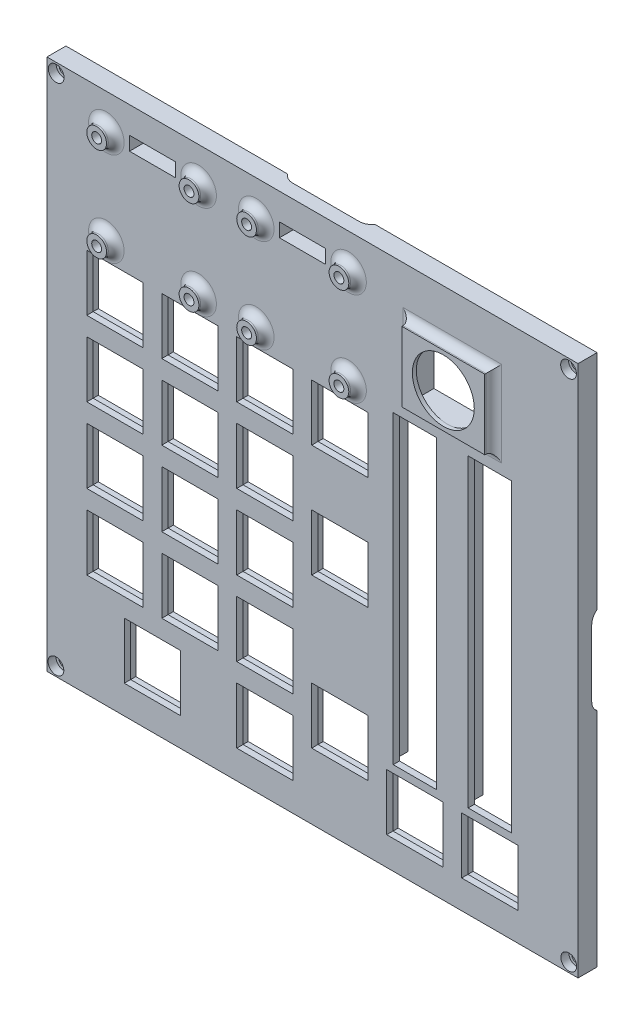
from build123d import *

# Parameters (mm, degrees)
SKETCH1_W                 = 126
SKETCH1_H                 = 126
SKETCH1_W_2               = 18.1
SKETCH1_H_2               = 18.1
SKETCH1_R                 = 1.25
SKETCH1_W_3               = 11.659999313
SKETCH1_H_3               = 3.5
BOSS_EXTRUDE1_DEPTH       = 3.2116
BOSS_EXTRUDE2_START       = 3.2116
BOSS_EXTRUDE2_OUTLINE_W   = 126
BOSS_EXTRUDE2_OUTLINE_H   = 126
BOSS_EXTRUDE2_OUTLINE_W_2 = 14.3
BOSS_EXTRUDE2_OUTLINE_H_2 = 14.3
BOSS_EXTRUDE2_OUTLINE_W_3 = 11
BOSS_EXTRUDE2_OUTLINE_H_3 = 77.272463861
BOSS_EXTRUDE2_OUTLINE_R   = 1.25
BOSS_EXTRUDE2_OUTLINE_W_4 = 11.659999313
BOSS_EXTRUDE2_OUTLINE_H_4 = 3.5
BOSS_EXTRUDE2_OUTLINE_W_5 = 19
BOSS_EXTRUDE2_OUTLINE_H_5 = 15.6999998
BOSS_EXTRUDE2_DEPTH       = 1.6
SKETCH3_R                 = 2.5
SKETCH3_R_2               = 1.25
BOSS_EXTRUDE3_DEPTH       = 2.4544
FILLET1_R                 = 2
SKETCH4_W                 = 21
SKETCH4_H                 = 17.6999998
SKETCH4_W_2               = 19
SKETCH4_H_2               = 15.6999998
BOSS_EXTRUDE4_DEPTH       = 2.3
BOSS_EXTRUDE5_START       = 7.1116
BOSS_EXTRUDE5_DEPTH       = 1
FILLET2_R                 = 2
BOSS_EXTRUDE6_DEPTH       = 3.45
BOSS_EXTRUDE7_DEPTH       = 3.55
BOSS_EXTRUDE8_START       = 3.55
BOSS_EXTRUDE8_DEPTH       = 3.55
BOSS_EXTRUDE9_START       = 3.7
BOSS_EXTRUDE9_DEPTH       = 3.7
BOSS_EXTRUDE10_DEPTH      = 0.8
BOSS_EXTRUDE11_DEPTH      = 0.8
BOSS_EXTRUDE12_START      = 0.8
BOSS_EXTRUDE12_DEPTH      = 0.8
BOSS_EXTRUDE13_START      = 0.8
BOSS_EXTRUDE13_DEPTH      = 0.8
SKETCH13_R                = 1.25
CUT_EXTRUDE1_DEPTH        = 4.8116
SKETCH14_R                = 2
CUT_EXTRUDE2_DEPTH        = 2


# Read off the part's stored shape, not the designer's step: Boss-Extrude2
with BuildPart() as part:
    # Sketch1 → Boss-Extrude1 (new body)
    with BuildSketch(Plane.XY):
        Rectangle(SKETCH1_W, SKETCH1_H)
        with Locations((-40.5, -53)):
            Rectangle(SKETCH1_W_2, SKETCH1_H_2, mode=Mode.SUBTRACT)
        with Locations((-50, -34)):
            Rectangle(SKETCH1_W_2, SKETCH1_H_2, mode=Mode.SUBTRACT)
        with Locations((-12, -53)):
            Rectangle(SKETCH1_W_2, SKETCH1_H_2, mode=Mode.SUBTRACT)
        with Locations((-31, -34)):
            Rectangle(SKETCH1_W_2, SKETCH1_H_2, mode=Mode.SUBTRACT)
        with Locations((-12, -34)):
            Rectangle(SKETCH1_W_2, SKETCH1_H_2, mode=Mode.SUBTRACT)
        with Locations((-50, -15)):
            Rectangle(SKETCH1_W_2, SKETCH1_H_2, mode=Mode.SUBTRACT)
        with Locations((-31, -15)):
            Rectangle(SKETCH1_W_2, SKETCH1_H_2, mode=Mode.SUBTRACT)
        with Locations((-12, -15)):
            Rectangle(SKETCH1_W_2, SKETCH1_H_2, mode=Mode.SUBTRACT)
        with Locations((7, -43.5)):
            Rectangle(SKETCH1_W_2, SKETCH1_H_2, mode=Mode.SUBTRACT)
        with Locations((7, -5.5)):
            Rectangle(SKETCH1_W_2, SKETCH1_H_2, mode=Mode.SUBTRACT)
        Polygon((35.05, -62.05), (16.95, -62.05), (16.95, -43.95), (19.5, -43.95), (19.5, 34.322463861), (32.5, 34.322463861), (32.5, -43.95), (35.05, -43.95), align=None, mode=Mode.SUBTRACT)
        Polygon((54.05, -62.05), (35.95, -62.05), (35.95, -43.95), (38.5, -43.95), (38.5, 34.322463861), (51.5, 34.322463861), (51.5, -43.95), (54.05, -43.95), align=None, mode=Mode.SUBTRACT)
        with Locations((-50, 4)):
            Rectangle(SKETCH1_W_2, SKETCH1_H_2, mode=Mode.SUBTRACT)
        with Locations((-50, 23)):
            Rectangle(SKETCH1_W_2, SKETCH1_H_2, mode=Mode.SUBTRACT)
        with Locations((-31, 4)):
            Rectangle(SKETCH1_W_2, SKETCH1_H_2, mode=Mode.SUBTRACT)
        with Locations((-12, 4)):
            Rectangle(SKETCH1_W_2, SKETCH1_H_2, mode=Mode.SUBTRACT)
        with Locations((-31, 23)):
            Rectangle(SKETCH1_W_2, SKETCH1_H_2, mode=Mode.SUBTRACT)
        with Locations((-12, 23)):
            Rectangle(SKETCH1_W_2, SKETCH1_H_2, mode=Mode.SUBTRACT)
        with Locations((-52.2, 34.7)):
            Circle(SKETCH1_R, mode=Mode.SUBTRACT)
        with Locations((-52.2, 58.5)):
            Circle(SKETCH1_R, mode=Mode.SUBTRACT)
        with Locations((-40.500000725, 59.025)):
            Rectangle(SKETCH1_W_3, SKETCH1_H_3, mode=Mode.SUBTRACT)
        with Locations((-28.8, 34.7)):
            Circle(SKETCH1_R, mode=Mode.SUBTRACT)
        with Locations((-14.2, 34.7)):
            Circle(SKETCH1_R, mode=Mode.SUBTRACT)
        with Locations((-28.8, 58.5)):
            Circle(SKETCH1_R, mode=Mode.SUBTRACT)
        with Locations((-14.2, 58.5)):
            Circle(SKETCH1_R, mode=Mode.SUBTRACT)
        with Locations((-2.500000725, 59.025)):
            Rectangle(SKETCH1_W_3, SKETCH1_H_3, mode=Mode.SUBTRACT)
        with Locations((7, 23)):
            Rectangle(SKETCH1_W_2, SKETCH1_H_2, mode=Mode.SUBTRACT)
        with Locations((9.2, 34.7)):
            Circle(SKETCH1_R, mode=Mode.SUBTRACT)
        with Locations((9.2, 58.5)):
            Circle(SKETCH1_R, mode=Mode.SUBTRACT)
        Polygon((35.5, 38.9500001), (26, 38.9500001), (26, 54.6499999), (35.5, 54.6499999), (45, 54.6499999), (45, 38.9500001), align=None, mode=Mode.SUBTRACT)
    extrude(amount=BOSS_EXTRUDE1_DEPTH)

    # Boss-Extrude2 outline → Boss-Extrude2 (add)
    with BuildSketch(Plane.XY.offset(BOSS_EXTRUDE2_START)):
        Rectangle(BOSS_EXTRUDE2_OUTLINE_W, BOSS_EXTRUDE2_OUTLINE_H)
        with Locations((-40.5, -53)):
            Rectangle(BOSS_EXTRUDE2_OUTLINE_W_2, BOSS_EXTRUDE2_OUTLINE_H_2, mode=Mode.SUBTRACT)
        with Locations((-50, -34)):
            Rectangle(BOSS_EXTRUDE2_OUTLINE_W_2, BOSS_EXTRUDE2_OUTLINE_H_2, mode=Mode.SUBTRACT)
        with Locations((-12, -53)):
            Rectangle(BOSS_EXTRUDE2_OUTLINE_W_2, BOSS_EXTRUDE2_OUTLINE_H_2, mode=Mode.SUBTRACT)
        with Locations((-31, -34)):
            Rectangle(BOSS_EXTRUDE2_OUTLINE_W_2, BOSS_EXTRUDE2_OUTLINE_H_2, mode=Mode.SUBTRACT)
        with Locations((-12, -34)):
            Rectangle(BOSS_EXTRUDE2_OUTLINE_W_2, BOSS_EXTRUDE2_OUTLINE_H_2, mode=Mode.SUBTRACT)
        with Locations((-50, -15)):
            Rectangle(BOSS_EXTRUDE2_OUTLINE_W_2, BOSS_EXTRUDE2_OUTLINE_H_2, mode=Mode.SUBTRACT)
        with Locations((-31, -15)):
            Rectangle(BOSS_EXTRUDE2_OUTLINE_W_2, BOSS_EXTRUDE2_OUTLINE_H_2, mode=Mode.SUBTRACT)
        with Locations((-12, -15)):
            Rectangle(BOSS_EXTRUDE2_OUTLINE_W_2, BOSS_EXTRUDE2_OUTLINE_H_2, mode=Mode.SUBTRACT)
        with Locations((26, -53)):
            Rectangle(BOSS_EXTRUDE2_OUTLINE_W_2, BOSS_EXTRUDE2_OUTLINE_H_2, mode=Mode.SUBTRACT)
        with Locations((7, -43.5)):
            Rectangle(BOSS_EXTRUDE2_OUTLINE_W_2, BOSS_EXTRUDE2_OUTLINE_H_2, mode=Mode.SUBTRACT)
        with Locations((45, -53)):
            Rectangle(BOSS_EXTRUDE2_OUTLINE_W_2, BOSS_EXTRUDE2_OUTLINE_H_2, mode=Mode.SUBTRACT)
        with Locations((7, -5.5)):
            Rectangle(BOSS_EXTRUDE2_OUTLINE_W_2, BOSS_EXTRUDE2_OUTLINE_H_2, mode=Mode.SUBTRACT)
        with Locations((26, -5.31376807)):
            Rectangle(BOSS_EXTRUDE2_OUTLINE_W_3, BOSS_EXTRUDE2_OUTLINE_H_3, mode=Mode.SUBTRACT)
        with Locations((45, -5.31376807)):
            Rectangle(BOSS_EXTRUDE2_OUTLINE_W_3, BOSS_EXTRUDE2_OUTLINE_H_3, mode=Mode.SUBTRACT)
        with Locations((-50, 4)):
            Rectangle(BOSS_EXTRUDE2_OUTLINE_W_2, BOSS_EXTRUDE2_OUTLINE_H_2, mode=Mode.SUBTRACT)
        with Locations((-50, 23)):
            Rectangle(BOSS_EXTRUDE2_OUTLINE_W_2, BOSS_EXTRUDE2_OUTLINE_H_2, mode=Mode.SUBTRACT)
        with Locations((-31, 4)):
            Rectangle(BOSS_EXTRUDE2_OUTLINE_W_2, BOSS_EXTRUDE2_OUTLINE_H_2, mode=Mode.SUBTRACT)
        with Locations((-12, 4)):
            Rectangle(BOSS_EXTRUDE2_OUTLINE_W_2, BOSS_EXTRUDE2_OUTLINE_H_2, mode=Mode.SUBTRACT)
        with Locations((-31, 23)):
            Rectangle(BOSS_EXTRUDE2_OUTLINE_W_2, BOSS_EXTRUDE2_OUTLINE_H_2, mode=Mode.SUBTRACT)
        with Locations((-12, 23)):
            Rectangle(BOSS_EXTRUDE2_OUTLINE_W_2, BOSS_EXTRUDE2_OUTLINE_H_2, mode=Mode.SUBTRACT)
        with Locations((-52.2, 34.7)):
            Circle(BOSS_EXTRUDE2_OUTLINE_R, mode=Mode.SUBTRACT)
        with Locations((-52.2, 58.5)):
            Circle(BOSS_EXTRUDE2_OUTLINE_R, mode=Mode.SUBTRACT)
        with Locations((-40.500000725, 59.025)):
            Rectangle(BOSS_EXTRUDE2_OUTLINE_W_4, BOSS_EXTRUDE2_OUTLINE_H_4, mode=Mode.SUBTRACT)
        with Locations((-28.8, 34.7)):
            Circle(BOSS_EXTRUDE2_OUTLINE_R, mode=Mode.SUBTRACT)
        with Locations((-14.2, 34.7)):
            Circle(BOSS_EXTRUDE2_OUTLINE_R, mode=Mode.SUBTRACT)
        with Locations((-28.8, 58.5)):
            Circle(BOSS_EXTRUDE2_OUTLINE_R, mode=Mode.SUBTRACT)
        with Locations((-14.2, 58.5)):
            Circle(BOSS_EXTRUDE2_OUTLINE_R, mode=Mode.SUBTRACT)
        with Locations((-2.500000725, 59.025)):
            Rectangle(BOSS_EXTRUDE2_OUTLINE_W_4, BOSS_EXTRUDE2_OUTLINE_H_4, mode=Mode.SUBTRACT)
        with Locations((7, 23)):
            Rectangle(BOSS_EXTRUDE2_OUTLINE_W_2, BOSS_EXTRUDE2_OUTLINE_H_2, mode=Mode.SUBTRACT)
        with Locations((9.2, 34.7)):
            Circle(BOSS_EXTRUDE2_OUTLINE_R, mode=Mode.SUBTRACT)
        with Locations((9.2, 58.5)):
            Circle(BOSS_EXTRUDE2_OUTLINE_R, mode=Mode.SUBTRACT)
        with Locations((35.5, 46.8)):
            Rectangle(BOSS_EXTRUDE2_OUTLINE_W_5, BOSS_EXTRUDE2_OUTLINE_H_5, mode=Mode.SUBTRACT)
    extrude(amount=BOSS_EXTRUDE2_DEPTH)

    # Sketch3 → Boss-Extrude3 (add)
    # profile 1 of 8: a face of its own
    with BuildSketch(Plane.XY.offset(4.8116)):
        with Locations(Location((-52.2, 58.5, 0), (0, 0, 180))):
            Circle(SKETCH3_R)
        with Locations((-52.2, 58.5)):
            Circle(SKETCH3_R_2, mode=Mode.SUBTRACT)
    # profile 2 of 8: a face of its own
    with BuildSketch(Plane.XY.offset(4.8116)):
        with Locations(Location((-28.8, 58.5, 0), (0, 0, 180))):
            Circle(SKETCH3_R)
        with Locations((-28.8, 58.5)):
            Circle(SKETCH3_R_2, mode=Mode.SUBTRACT)
    # profile 3 of 8: a face of its own
    with BuildSketch(Plane.XY.offset(4.8116)):
        with Locations(Location((-14.2, 58.5, 0), (0, 0, 180))):
            Circle(SKETCH3_R)
        with Locations((-14.2, 58.5)):
            Circle(SKETCH3_R_2, mode=Mode.SUBTRACT)
    # profile 4 of 8: a face of its own
    with BuildSketch(Plane.XY.offset(4.8116)):
        with Locations(Location((9.2, 58.5, 0), (0, 0, 180))):
            Circle(SKETCH3_R)
        with Locations((9.2, 58.5)):
            Circle(SKETCH3_R_2, mode=Mode.SUBTRACT)
    # profile 5 of 8: a face of its own
    with BuildSketch(Plane.XY.offset(4.8116)):
        with Locations(Location((-52.2, 34.7, 0), (0, 0, 180))):
            Circle(SKETCH3_R)
        with Locations((-52.2, 34.7)):
            Circle(SKETCH3_R_2, mode=Mode.SUBTRACT)
    # profile 6 of 8: a face of its own
    with BuildSketch(Plane.XY.offset(4.8116)):
        with Locations(Location((-28.8, 34.7, 0), (0, 0, 180))):
            Circle(SKETCH3_R)
        with Locations((-28.8, 34.7)):
            Circle(SKETCH3_R_2, mode=Mode.SUBTRACT)
    # profile 7 of 8: a face of its own
    with BuildSketch(Plane.XY.offset(4.8116)):
        with Locations(Location((-14.2, 34.7, 0), (0, 0, 180))):
            Circle(SKETCH3_R)
        with Locations((-14.2, 34.7)):
            Circle(SKETCH3_R_2, mode=Mode.SUBTRACT)
    # profile 8 of 8: a face of its own
    with BuildSketch(Plane.XY.offset(4.8116)):
        with Locations(Location((9.2, 34.7, 0), (0, 0, 180))):
            Circle(SKETCH3_R)
        with Locations((9.2, 34.7)):
            Circle(SKETCH3_R_2, mode=Mode.SUBTRACT)
    extrude(amount=BOSS_EXTRUDE3_DEPTH)

    # Fillet1
    fillet1_edges = [part.edges().sort_by_distance(p)[0] for p in [
        (-49.7, 58.5, 4.8116),
        (-26.3, 58.5, 4.8116),
        (-11.7, 58.5, 4.8116),
        (11.7, 58.5, 4.8116),
        (-49.7, 34.7, 4.8116),
        (-26.3, 34.7, 4.8116),
        (-11.7, 34.7, 4.8116),
        (11.7, 34.7, 4.8116),
    ]]
    fillet(fillet1_edges, radius=FILLET1_R - 0.0001)  # a hair under: the kernel refuses the full size

    # Sketch4 → Boss-Extrude4 (add)
    with BuildSketch(Plane.XY.offset(4.8116)):
        with Locations((35.5, 46.8)):
            Rectangle(SKETCH4_W, SKETCH4_H)
        with Locations((35.5, 46.8)):
            Rectangle(SKETCH4_W_2, SKETCH4_H_2, mode=Mode.SUBTRACT)
    extrude(amount=BOSS_EXTRUDE4_DEPTH)

    # Sketch1<6> → Boss-Extrude5 (add)
    with BuildSketch(Plane.XY.offset(BOSS_EXTRUDE5_START)):
        with BuildLine():
            Line((26, 54.6499999), (26, 38.9500001))
            Line((26, 38.9500001), (35.5, 38.9500001))
            ThreePointArc((35.5, 38.9500001), (27.6500001, 46.8), (35.5, 54.6499999))
            Line((35.5, 54.6499999), (26, 54.6499999))
        make_face()
        with BuildLine():
            ThreePointArc((43.3499999, 46.8), (41.050788162, 41.249211838), (35.5, 38.9500001))
            Line((35.5, 38.9500001), (45, 38.9500001))
            Line((45, 38.9500001), (45, 54.6499999))
            Line((45, 54.6499999), (35.5, 54.6499999))
            ThreePointArc((35.5, 54.6499999), (41.050788162, 52.350788162), (43.3499999, 46.8))
        make_face()
    extrude(amount=-BOSS_EXTRUDE5_DEPTH)

    # Fillet2
    fillet2_edges = [part.edges().sort_by_distance(p)[0] for p in [
        (25, 46.8, 4.8116),
        (35.5, 37.9500001, 4.8116),
        (46, 46.8, 4.8116),
        (35.5, 55.6499999, 4.8116),
    ]]
    fillet(fillet2_edges, radius=FILLET2_R)

    # Sketch5 → Boss-Extrude6 (add)
    with BuildSketch(Plane.ZY.offset(63)):
        with BuildLine():
            ThreePointArc((0, 13.082575695), (2.183300133, 11.238612788), (3, 8.5))
            Line((3, 8.5), (3, -8.5))
            ThreePointArc((3, -8.5), (2.183300133, -11.238612788), (0, -13.082575695))
            Line((0, -13.082575695), (0, -63))
            Line((0, -63), (4.8116, -63))
            Line((4.8116, -63), (4.8116, 63))
            Line((4.8116, 63), (0, 63))
            Line((0, 63), (0, 13.082575695))
        make_face()
    extrude(amount=BOSS_EXTRUDE6_DEPTH)

    # Sketch6 → Boss-Extrude7 (add)
    with BuildSketch(Plane.XZ.offset(63)):
        with BuildLine():
            ThreePointArc((-13.082575695, 0), (-11.238612788, 2.183300133), (-8.5, 3))
            Line((-8.5, 3), (8.5, 3))
            ThreePointArc((8.5, 3), (11.238612788, 2.183300133), (13.082575695, 0))
            Line((13.082575695, 0), (63, 0))
            Line((63, 0), (63, 4.8116))
            Line((63, 4.8116), (-66.45, 4.8116))
            Line((-66.45, 4.8116), (-66.45, 0))
            Line((-66.45, 0), (-13.082575695, 0))
        make_face()
    extrude(amount=BOSS_EXTRUDE7_DEPTH)

    # Sketch7 → Boss-Extrude8 (add)
    with BuildSketch(Plane(origin=(63, 0, 0), x_dir=(0, 0, -1), z_dir=(1, 0, 0)).offset(BOSS_EXTRUDE8_START)):
        with BuildLine():
            ThreePointArc((0, -13.082575695), (-2.183300133, -11.238612788), (-3, -8.5))
            Line((-3, -8.5), (-3, 8.5))
            ThreePointArc((-3, 8.5), (-2.183300133, 11.238612788), (0, 13.082575695))
            Line((0, 13.082575695), (0, 63))
            Line((0, 63), (-4.8116, 63))
            Line((-4.8116, 63), (-4.8116, -66.55))
            Line((-4.8116, -66.55), (0, -66.55))
            Line((0, -66.55), (0, -13.082575695))
        make_face()
    extrude(amount=-BOSS_EXTRUDE8_DEPTH)

    # Sketch8 → Boss-Extrude9 (add)
    with BuildSketch(Plane(origin=(0, 63, 0), x_dir=(1, 0, 0), z_dir=(0, 1, 0)).offset(BOSS_EXTRUDE9_START)):
        with BuildLine():
            ThreePointArc((13.082575695, 0), (11.238612788, -2.183300133), (8.5, -3))
            Line((8.5, -3), (-8.5, -3))
            ThreePointArc((-8.5, -3), (-11.238612788, -2.183300133), (-13.082575695, 0))
            Line((-13.082575695, 0), (-66.45, 0))
            Line((-66.45, 0), (-66.45, -4.8116))
            Line((-66.45, -4.8116), (-52.2, -4.8116))
            Line((-52.2, -4.8116), (-28.8, -4.8116))
            Line((-28.8, -4.8116), (-14.2, -4.8116))
            Line((-14.2, -4.8116), (9.2, -4.8116))
            Line((9.2, -4.8116), (66.55, -4.8116))
            Line((66.55, -4.8116), (66.55, 0))
            Line((66.55, 0), (13.082575695, 0))
        make_face()
    extrude(amount=-BOSS_EXTRUDE9_DEPTH)

    # Sketch9 → Boss-Extrude10 (add)
    with BuildSketch(Plane.ZY.offset(66.45)):
        with BuildLine():
            Line((3, 8.5), (3, -8.5))
            ThreePointArc((3, -8.5), (2.183300133, -11.238612788), (0, -13.082575695))
            Line((0, -13.082575695), (0, -66.55))
            Line((0, -66.55), (4.8116, -66.55))
            Line((4.8116, -66.55), (4.8116, 66.7))
            Line((4.8116, 66.7), (0, 66.7))
            Line((0, 66.7), (0, 13.082575695))
            ThreePointArc((0, 13.082575695), (2.183300133, 11.238612788), (3, 8.5))
        make_face()
        with BuildLine():
            ThreePointArc((0, 11.08747093), (0.9935347, 9.903745324), (1.35, 8.4))
            Line((1.35, 8.4), (1.35, -8.4))
            ThreePointArc((1.35, -8.4), (0.9935347, -9.903745324), (0, -11.08747093))
            Line((0, -11.08747093), (0, -13.082575695))
            ThreePointArc((0, -13.082575695), (2.183300133, -11.238612788), (3, -8.5))
            Line((3, -8.5), (3, 8.5))
            ThreePointArc((3, 8.5), (2.183300133, 11.238612788), (0, 13.082575695))
            Line((0, 13.082575695), (0, 11.08747093))
        make_face()
    extrude(amount=BOSS_EXTRUDE10_DEPTH)

    # Sketch10 → Boss-Extrude11 (add)
    with BuildSketch(Plane.XZ.offset(66.55)):
        with BuildLine():
            Line((-8.5, 3), (8.5, 3))
            ThreePointArc((8.5, 3), (11.238612788, 2.183300133), (13.082575695, 0))
            Line((13.082575695, 0), (66.55, 0))
            Line((66.55, 0), (66.55, 4.8116))
            Line((66.55, 4.8116), (-67.25, 4.8116))
            Line((-67.25, 4.8116), (-67.25, 0))
            Line((-67.25, 0), (-13.082575695, 0))
            ThreePointArc((-13.082575695, 0), (-11.238612788, 2.183300133), (-8.5, 3))
        make_face()
        with BuildLine():
            ThreePointArc((-11.08747093, 0), (-9.903745324, 0.9935347), (-8.4, 1.35))
            Line((-8.4, 1.35), (8.4, 1.35))
            ThreePointArc((8.4, 1.35), (9.903745324, 0.9935347), (11.08747093, 0))
            Line((11.08747093, 0), (13.082575695, 0))
            ThreePointArc((13.082575695, 0), (11.238612788, 2.183300133), (8.5, 3))
            Line((8.5, 3), (-8.5, 3))
            ThreePointArc((-8.5, 3), (-11.238612788, 2.183300133), (-13.082575695, 0))
            Line((-13.082575695, 0), (-11.08747093, 0))
        make_face()
    extrude(amount=BOSS_EXTRUDE11_DEPTH)

    # Sketch11 → Boss-Extrude12 (add)
    with BuildSketch(Plane(origin=(66.55, 0, 0), x_dir=(0, 0, -1), z_dir=(1, 0, 0)).offset(BOSS_EXTRUDE12_START)):
        with BuildLine():
            Line((-3, -8.5), (-3, 8.5))
            ThreePointArc((-3, 8.5), (-2.183300133, 11.238612788), (0, 13.082575695))
            Line((0, 13.082575695), (0, 66.7))
            Line((0, 66.7), (-4.8116, 66.7))
            Line((-4.8116, 66.7), (-4.8116, -67.35))
            Line((-4.8116, -67.35), (0, -67.35))
            Line((0, -67.35), (0, -13.082575695))
            ThreePointArc((0, -13.082575695), (-2.183300133, -11.238612788), (-3, -8.5))
        make_face()
        with BuildLine():
            ThreePointArc((0, -11.08747093), (-0.9935347, -9.903745324), (-1.35, -8.4))
            Line((-1.35, -8.4), (-1.35, 8.4))
            ThreePointArc((-1.35, 8.4), (-0.9935347, 9.903745324), (0, 11.08747093))
            Line((0, 11.08747093), (0, 13.082575695))
            ThreePointArc((0, 13.082575695), (-2.183300133, 11.238612788), (-3, 8.5))
            Line((-3, 8.5), (-3, -8.5))
            ThreePointArc((-3, -8.5), (-2.183300133, -11.238612788), (0, -13.082575695))
            Line((0, -13.082575695), (0, -11.08747093))
        make_face()
    extrude(amount=-BOSS_EXTRUDE12_DEPTH)

    # Sketch12 → Boss-Extrude13 (add)
    with BuildSketch(Plane(origin=(0, 66.7, 0), x_dir=(1, 0, 0), z_dir=(0, 1, 0)).offset(BOSS_EXTRUDE13_START)):
        with BuildLine():
            Line((8.5, -3), (-8.5, -3))
            ThreePointArc((-8.5, -3), (-11.238612788, -2.183300133), (-13.082575695, 0))
            Line((-13.082575695, 0), (-67.25, 0))
            Line((-67.25, 0), (-67.25, -4.8116))
            Line((-67.25, -4.8116), (67.35, -4.8116))
            Line((67.35, -4.8116), (67.35, 0))
            Line((67.35, 0), (13.082575695, 0))
            ThreePointArc((13.082575695, 0), (11.238612788, -2.183300133), (8.5, -3))
        make_face()
        with BuildLine():
            ThreePointArc((11.08747093, 0), (9.903745324, -0.9935347), (8.4, -1.35))
            Line((8.4, -1.35), (-8.4, -1.35))
            ThreePointArc((-8.4, -1.35), (-9.903745324, -0.9935347), (-11.08747093, 0))
            Line((-11.08747093, 0), (-13.082575695, 0))
            ThreePointArc((-13.082575695, 0), (-11.238612788, -2.183300133), (-8.5, -3))
            Line((-8.5, -3), (8.5, -3))
            ThreePointArc((8.5, -3), (11.238612788, -2.183300133), (13.082575695, 0))
            Line((13.082575695, 0), (11.08747093, 0))
        make_face()
    extrude(amount=-BOSS_EXTRUDE13_DEPTH)

    # Sketch13 → Cut-Extrude1 (cut)
    with BuildSketch(Plane(origin=(0, 0, 0), x_dir=(-1, 0, 0), z_dir=(0, 0, -1))):
        with Locations((-64.935404467, 65.056545539)):
            Circle(SKETCH13_R)
        with Locations((-64.997056275, -64.997056275)):
            Circle(SKETCH13_R)
        with Locations((64.975712162, -65.018135254)):
            Circle(SKETCH13_R)
        with Locations((64.913397924, 65.076779992)):
            Circle(SKETCH13_R)
    extrude(amount=-CUT_EXTRUDE1_DEPTH, mode=Mode.SUBTRACT)

    # Sketch14 → Cut-Extrude2 (cut)
    with BuildSketch(Plane.XY.offset(4.8116)):
        with Locations((-64.975712162, -65.018135254)):
            Circle(SKETCH14_R)
        with Locations((64.997056275, -64.997056275)):
            Circle(SKETCH14_R)
        with Locations((64.935404467, 65.056545539)):
            Circle(SKETCH14_R)
        with Locations((-64.913397924, 65.076779992)):
            Circle(SKETCH14_R)
    extrude(amount=-CUT_EXTRUDE2_DEPTH, mode=Mode.SUBTRACT)


solid = part.part
